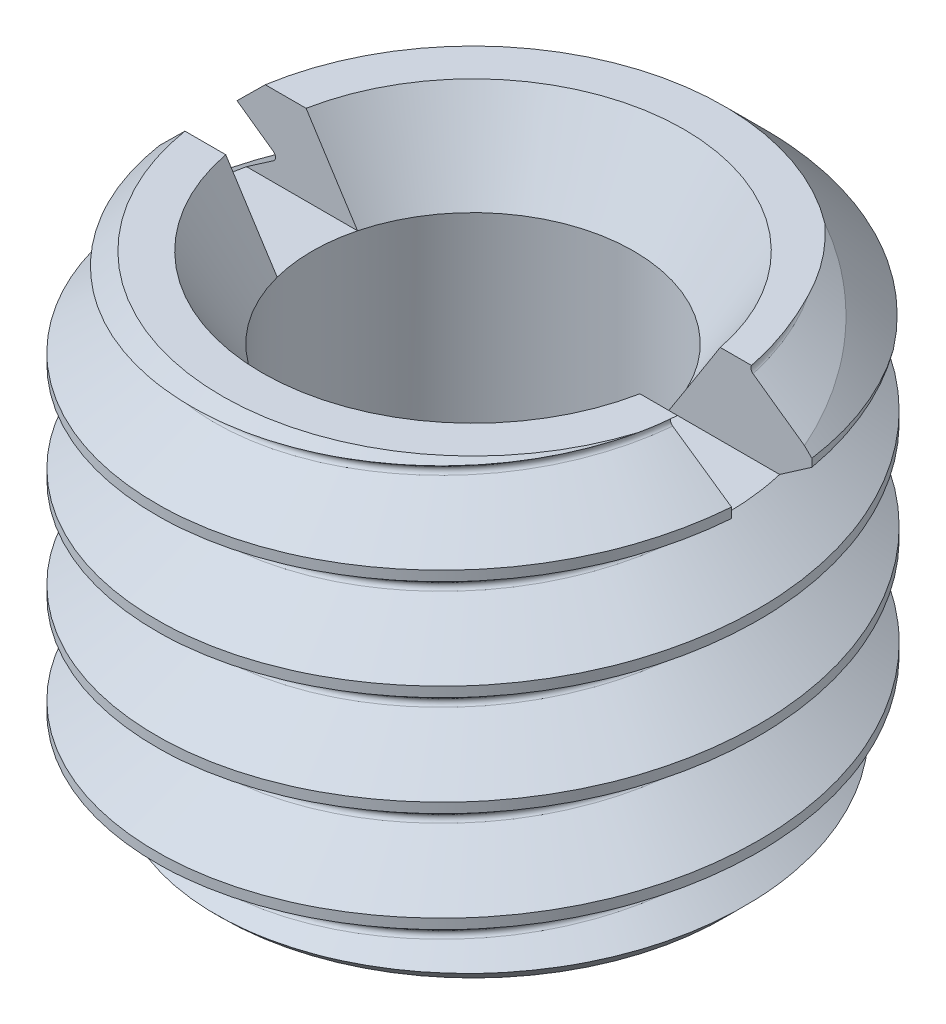
from build123d import *

# Parameters (mm, degrees)
CUT_SWEEP1_PITCH   = 1
SKETCH4_W          = 9.279661014
SKETCH4_H          = 0.8
CUT_EXTRUDE1_DEPTH = 0.8


with BuildPart() as part:
    # Sketch1 → Revolve1 (revolve)
    with BuildSketch(Plane.XY, mode=Mode.PRIVATE) as revolve1_sk:
        Polygon((2.5, 4.5), (3, 4), (3, 0.5), (2.5, 0), (1.6, 0), (1.6, 3.7), (2.1, 4.5), align=None)
    revolve(revolve1_sk.sketch.rotate(Axis((0, 0, 0), (0, 1, 0)), 90), axis=Axis((0, 0, 0), (0, 1, 0)))

    # Cut-Sweep1: the profile of Sketch3 screwed along a right-hand helix of 5.5 turns, 8 arcs to a turn; built about Z, then put on its axis
    cut_sweep1_z = Axis((0, 0, 0), (0, 0, 1))
    cut_sweep1_corners = [(3, 0, 0), (3, 0.047679434, -0.898736152), (2.421139351, 0.026002757, -0.490140422), (2.4, 0.023839717, -0.449368076), (2.421139351, 0.021676677, -0.40859573)]
    with BuildLine(mode=Mode.PRIVATE) as cut_sweep1_profile:
        Line(cut_sweep1_corners[0], cut_sweep1_corners[1])
        Line(cut_sweep1_corners[1], cut_sweep1_corners[2])
        Line(cut_sweep1_corners[4], cut_sweep1_corners[0])
        ThreePointArc((2.421139351, 0.026002757, -0.490140422), (2.405598241, 0.025057597, -0.472324569), (2.4, 0.023839717, -0.449368076))
        ThreePointArc((2.4, 0.023839717, -0.449368076), (2.405598241, 0.022621837, -0.426411584), (2.421139351, 0.021676677, -0.40859573))
    cut_sweep1_cap = Face(cut_sweep1_profile.wire())
    cut_sweep1_arcs = [((2.421139351, 0.026002757, -0.490140422), (2.4, 0.025211149, -0.475218958), (2.4, 0.023839717, -0.449368076), (1, 0.8880351850424166, 1)), ((2.4, 0.023839717, -0.449368076), (2.4, 0.022468285, -0.423517195), (2.421139351, 0.021676677, -0.40859573), (1, 0.8880351850424166, 1))]  # start, shoulder, end, weights
    cut_sweep1_turn_angles = [0, 22.5, 45, 67.5, 90, 112.5, 135, 157.5, 180, 202.5, 225, 247.5, 270, 292.5, 315, 337.5, 360]
    cut_sweep1_turn_weights = [1, 0.9238795325112867, 1, 0.9238795325112867, 1, 0.9238795325112867, 1, 0.9238795325112867, 1, 0.9238795325112867, 1, 0.9238795325112867, 1, 0.9238795325112867, 1, 0.9238795325112867, 1]
    cut_sweep1_turn_rails = [Edge.make_bspline([Vector(p[0], p[1], 0).rotate(cut_sweep1_z, cut_sweep1_turn_angles[k]) / cut_sweep1_turn_weights[k] + Vector(0, 0, p[2] + CUT_SWEEP1_PITCH * cut_sweep1_turn_angles[k] / 360) for k in range(17)], [0, 0, 0, 1, 1, 2, 2, 3, 3, 4, 4, 5, 5, 6, 6, 7, 7, 8, 8, 8], 2, cut_sweep1_turn_weights) for p in cut_sweep1_corners]
    cut_sweep1_turn_sides = [*[Face.make_surface_from_curves(cut_sweep1_turn_rails[p[0]], cut_sweep1_turn_rails[p[1]]) for p in [(0, 1), (1, 2), (4, 0)]], *[Face.make_bezier_surface([[Vector(p[j][0], p[j][1], 0).rotate(cut_sweep1_z, cut_sweep1_turn_angles[2 * i + k]) / cut_sweep1_turn_weights[2 * i + k] + Vector(0, 0, p[j][2] + CUT_SWEEP1_PITCH * cut_sweep1_turn_angles[2 * i + k] / 360) for k in range(3)] for j in range(3)], [[p[3][j] * cut_sweep1_turn_weights[2 * i + k] for k in range(3)] for j in range(3)]) for p in cut_sweep1_arcs for i in range(8)]]
    cut_sweep1_last_angles = [1800, 1822.5, 1845, 1867.5, 1890, 1912.5, 1935, 1957.5, 1980]
    cut_sweep1_last_weights = [1, 0.9238795325112867, 1, 0.9238795325112867, 1, 0.9238795325112867, 1, 0.9238795325112678, 1]
    cut_sweep1_last_rails = [Edge.make_bspline([Vector(p[0], p[1], 0).rotate(cut_sweep1_z, cut_sweep1_last_angles[k]) / cut_sweep1_last_weights[k] + Vector(0, 0, p[2] + CUT_SWEEP1_PITCH * cut_sweep1_last_angles[k] / 360) for k in range(9)], [0, 0, 0, 1, 1, 2, 2, 3, 3, 4, 4, 4], 2, cut_sweep1_last_weights) for p in cut_sweep1_corners]
    cut_sweep1_last_sides = [*[Face.make_surface_from_curves(cut_sweep1_last_rails[p[0]], cut_sweep1_last_rails[p[1]]) for p in [(0, 1), (1, 2), (4, 0)]], *[Face.make_bezier_surface([[Vector(p[j][0], p[j][1], 0).rotate(cut_sweep1_z, cut_sweep1_last_angles[2 * i + k]) / cut_sweep1_last_weights[2 * i + k] + Vector(0, 0, p[j][2] + CUT_SWEEP1_PITCH * cut_sweep1_last_angles[2 * i + k] / 360) for k in range(3)] for j in range(3)], [[p[3][j] * cut_sweep1_last_weights[2 * i + k] for k in range(3)] for j in range(3)]) for p in cut_sweep1_arcs for i in range(4)]]
    cut_sweep1 = Plane(origin=(0, 4.5, 0), x_dir=(-1, 0, 0), z_dir=(0, -1, 0)) * Solid(Shell([*[p.moved(Location((0, 0, CUT_SWEEP1_PITCH * i))) for i in range(5) for p in cut_sweep1_turn_sides], *cut_sweep1_last_sides, cut_sweep1_cap, cut_sweep1_cap.rotate(cut_sweep1_z, 1980).moved(Location((0, 0, CUT_SWEEP1_PITCH * 1980 / 360)))]))
    add(cut_sweep1, mode=Mode.SUBTRACT)

    # Sketch4 → Cut-Extrude1 (cut)
    with BuildSketch(Plane(origin=(0, 4.5, 0), x_dir=(1, 0, 0), z_dir=(0, 1, 0))):
        Rectangle(SKETCH4_W, SKETCH4_H)
    extrude(amount=-CUT_EXTRUDE1_DEPTH, mode=Mode.SUBTRACT)


solid = part.part
